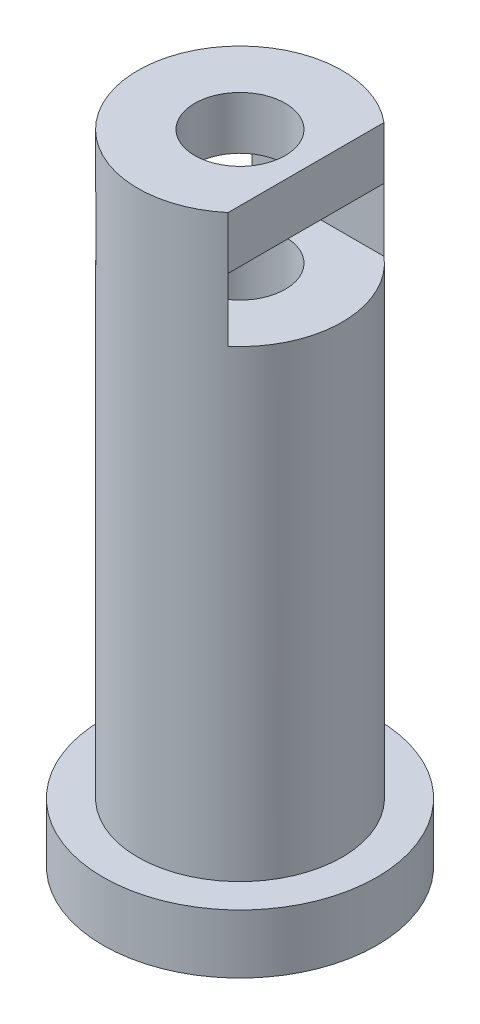
from build123d import *

# Parameters (mm, degrees)
SKETCH1_R              = 4.85
SKETCH1_R_2            = 3
SKETCH1_R_3            = 2.15
BOSS_EXTRUDE1_DEPTH    = 27.5
BOSS_EXTRUDE2_START    = -2.8
SKETCH1_3_R            = 6.5
SKETCH1_3_R_2          = 4.85
SKETCH1_3_R_3          = 3
SKETCH1_3_R_4          = 2.15
BOSS_EXTRUDE2_DEPTH    = 2.8
CUT_EXTRUDE1_START     = 22
CUT_EXTRUDE1_OUTLINE_R = 2.15
CUT_EXTRUDE1_DEPTH     = 3
CUT_EXTRUDE2_START     = 12.5
SKETCH2_3_R            = 2.15
CUT_EXTRUDE2_DEPTH     = 15
CUT_EXTRUDE3_START     = 22
CUT_EXTRUDE3_DEPTH     = 15
CUT_EXTRUDE4_START     = -2.8
SKETCH3_R              = 2.35
CUT_EXTRUDE4_DEPTH     = 1


# Read off the part's stored shape, not the designer's step: Cut-Extrude1
with BuildPart() as part:
    # Sketch1 → Boss-Extrude1 (new body)
    # profile 1 of 3: a face of its own
    with BuildSketch(Plane(origin=(0, 0, 0), x_dir=(1, 0, 0), z_dir=(0, 1, 0))):
        with Locations(Location((0, 0, 0), (0, 0, 270))):
            Circle(SKETCH1_R)
        Circle(SKETCH1_R_2, mode=Mode.SUBTRACT)
    # profile 2 of 3: a face of its own
    with BuildSketch(Plane(origin=(0, 0, 0), x_dir=(1, 0, 0), z_dir=(0, 1, 0))):
        Circle(SKETCH1_R_2)
        Circle(SKETCH1_R_3, mode=Mode.SUBTRACT)
    # profile 3 of 3: a face of its own
    with BuildSketch(Plane(origin=(0, 0, 0), x_dir=(1, 0, 0), z_dir=(0, 1, 0))):
        Circle(SKETCH1_R_3)
    extrude(amount=BOSS_EXTRUDE1_DEPTH)

    # Sketch1<3> → Boss-Extrude2 (add)
    # profile 1 of 4: a face of its own
    with BuildSketch(Plane(origin=(0, 0, 0), x_dir=(1, 0, 0), z_dir=(0, 1, 0)).offset(BOSS_EXTRUDE2_START)):
        with Locations(Location((0, 0, 0), (0, 0, 270))):
            Circle(SKETCH1_3_R)
        with Locations(Location((0, 0, 0), (0, 0, 270))):
            Circle(SKETCH1_3_R_2, mode=Mode.SUBTRACT)
    # profile 2 of 4: a face of its own
    with BuildSketch(Plane(origin=(0, 0, 0), x_dir=(1, 0, 0), z_dir=(0, 1, 0)).offset(BOSS_EXTRUDE2_START)):
        with Locations(Location((0, 0, 0), (0, 0, 270))):
            Circle(SKETCH1_3_R_2)
        Circle(SKETCH1_3_R_3, mode=Mode.SUBTRACT)
    # profile 3 of 4: a face of its own
    with BuildSketch(Plane(origin=(0, 0, 0), x_dir=(1, 0, 0), z_dir=(0, 1, 0)).offset(BOSS_EXTRUDE2_START)):
        Circle(SKETCH1_3_R_3)
        Circle(SKETCH1_3_R_4, mode=Mode.SUBTRACT)
    # profile 4 of 4: a face of its own
    with BuildSketch(Plane(origin=(0, 0, 0), x_dir=(1, 0, 0), z_dir=(0, 1, 0)).offset(BOSS_EXTRUDE2_START)):
        Circle(SKETCH1_3_R_4)
    extrude(amount=BOSS_EXTRUDE2_DEPTH)

    # Cut-Extrude1 outline → Cut-Extrude1 (cut)
    with BuildSketch(Plane(origin=(0, 0, 0), x_dir=(1, 0, 0), z_dir=(0, 1, 0)).offset(CUT_EXTRUDE1_START)):
        with BuildLine():
            ThreePointArc((-3.135681744, 3.7), (-4.85, 0), (-3.135681744, -3.7))
            Line((-3.135681744, -3.7), (3.135681744, -3.7))
            ThreePointArc((3.135681744, -3.7), (4.85, 0), (3.135681744, 3.7))
            Line((3.135681744, 3.7), (-3.135681744, 3.7))
        make_face()
        Circle(CUT_EXTRUDE1_OUTLINE_R, mode=Mode.SUBTRACT)
    extrude(amount=CUT_EXTRUDE1_DEPTH, mode=Mode.SUBTRACT)

    # Sketch2<3> → Cut-Extrude2 (cut)
    with BuildSketch(Plane(origin=(0, 0, 0), x_dir=(1, 0, 0), z_dir=(0, 1, 0)).offset(CUT_EXTRUDE2_START)):
        with Locations(Location((0, 0, 0), (0, 0, 270))):
            Circle(SKETCH2_3_R)
    extrude(amount=CUT_EXTRUDE2_DEPTH, mode=Mode.SUBTRACT)

    # Sketch2<4> → Cut-Extrude3 (cut)
    with BuildSketch(Plane(origin=(0, 0, 0), x_dir=(1, 0, 0), z_dir=(0, 1, 0)).offset(CUT_EXTRUDE3_START)):
        Polygon((4.272391992, 0), (3.135681744, 1.968839903), (3.135681744, -1.968839903), align=None)
        with BuildLine():
            ThreePointArc((4.85, 0), (4.400599758, 2.038926622), (3.135681744, 3.7))
            Line((3.135681744, 3.7), (3.135681744, 1.968839903))
            Line((3.135681744, 1.968839903), (4.272391992, 0))
            Line((4.272391992, 0), (3.135681744, -1.968839903))
            Line((3.135681744, -1.968839903), (3.135681744, -3.7))
            ThreePointArc((3.135681744, -3.7), (4.400599758, -2.038926622), (4.85, 0))
        make_face()
    extrude(amount=CUT_EXTRUDE3_DEPTH, mode=Mode.SUBTRACT)

    # Sketch3 → Cut-Extrude4 (cut)
    with BuildSketch(Plane(origin=(0, 0, 0), x_dir=(1, 0, 0), z_dir=(0, 1, 0)).offset(CUT_EXTRUDE4_START)):
        with Locations(Location((0, 0, 0), (0, 0, 270))):
            Circle(SKETCH3_R)
    extrude(amount=CUT_EXTRUDE4_DEPTH, mode=Mode.SUBTRACT)


solid = part.part
